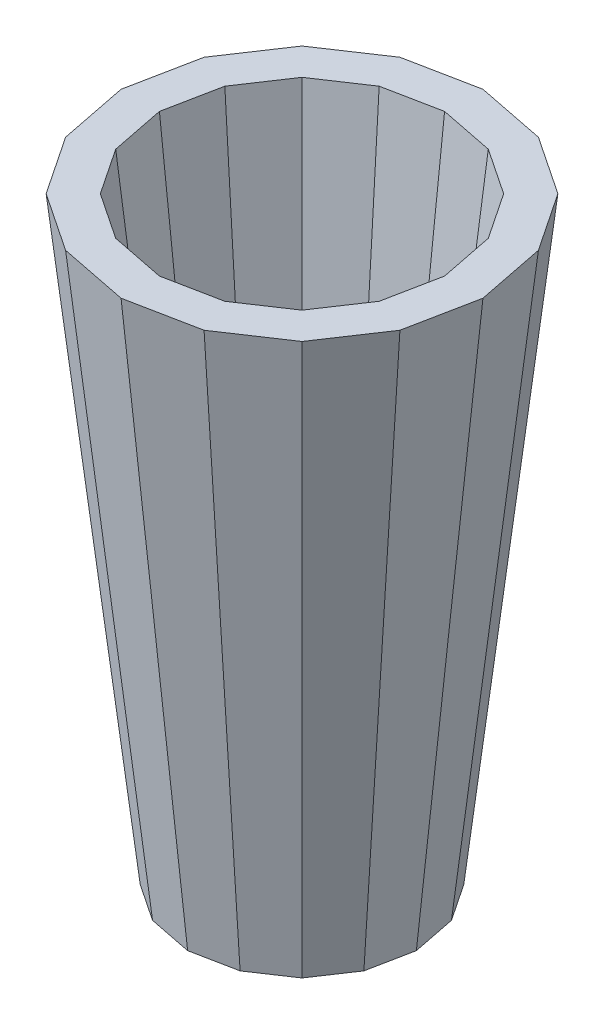
from build123d import *

# Parameters (mm, degrees)
SHELL1_T                = -19.05
SKETCH3_W               = 50.8
SKETCH3_H               = 50.8
BOSS_EXTRUDE1_DEPTH     = 35.56
CIRPATTERN1_COUNT       = 16
CUT_EXTRUDE1_REACH      = 373.537
SKETCH8_R               = 38.1
FILLET1_R               = 25.4
CUT_EXTRUDE2_DEPTH      = 372.53665238
CUT_EXTRUDE2_DEPTH_BACK = 25.4
SKETCH9_R               = 186.983253042


with BuildPart() as part:
    # Sketch1 → Loft1 section 0
    with BuildSketch(Plane(origin=(0, 0, 0), x_dir=(1, 0, 0), z_dir=(0, 1, 0))):
        with BuildLine():
            Line((120.431396889, 0), (111.264102658, 46.087100326))
            Line((111.264102658, 46.087100326), (85.157857408, 85.157857408))
            Line((85.157857408, 85.157857408), (46.087100326, 111.264102658))
            Line((46.087100326, 111.264102658), (0, 120.431396889))
            Line((0, 120.431396889), (-46.087100326, 111.264102658))
            Line((-46.087100326, 111.264102658), (-85.157857408, 85.157857408))
            Line((-85.157857408, 85.157857408), (-111.264102658, 46.087100326))
            Line((-111.264102658, 46.087100326), (-120.431396889, 0))
            Line((-120.431396889, 0), (-111.264102658, -46.087100326))
            Line((-111.264102658, -46.087100326), (-85.157857408, -85.157857408))
            Line((-85.157857408, -85.157857408), (-46.087100326, -111.264102658))
            Line((-46.087100326, -111.264102658), (0, -120.431396889))
            Line((0, -120.431396889), (46.087100326, -111.264102658))
            Line((46.087100326, -111.264102658), (85.157857408, -85.157857408))
            Line((85.157857408, -85.157857408), (111.264102658, -46.087100326))
            Line((111.264102658, -46.087100326), (120.431396889, 0))
        make_face()
    # Sketch2 → Loft1 section 1
    with BuildSketch(Plane(origin=(0, -558.8, 0), x_dir=(1, 0, 0), z_dir=(0, 1, 0))):
        with BuildLine():
            Line((58.269634692, 0), (53.834122858, 22.298823806))
            Line((53.834122858, 22.298823806), (41.202853828, 41.202853828))
            Line((41.202853828, 41.202853828), (22.298823806, 53.834122858))
            Line((22.298823806, 53.834122858), (0, 58.269634692))
            Line((0, 58.269634692), (-22.298823806, 53.834122858))
            Line((-22.298823806, 53.834122858), (-41.202853828, 41.202853828))
            Line((-41.202853828, 41.202853828), (-53.834122858, 22.298823806))
            Line((-53.834122858, 22.298823806), (-58.269634692, 0))
            Line((-58.269634692, 0), (-53.834122858, -22.298823806))
            Line((-53.834122858, -22.298823806), (-41.202853828, -41.202853828))
            Line((-41.202853828, -41.202853828), (-22.298823806, -53.834122858))
            Line((-22.298823806, -53.834122858), (0, -58.269634692))
            Line((0, -58.269634692), (22.298823806, -53.834122858))
            Line((22.298823806, -53.834122858), (41.202853828, -41.202853828))
            Line((41.202853828, -41.202853828), (53.834122858, -22.298823806))
            Line((53.834122858, -22.298823806), (58.269634692, 0))
        make_face()
    loft()

    # Shell1
    shell1_openings = [part.faces().sort_by_distance(p)[0] for p in [
        (0, -558.8, 0),
        (0, 0, 0),
    ]]
    offset(amount=SHELL1_T, openings=shell1_openings, kind=Kind.INTERSECTION)

    # Sketch3 → Boss-Extrude1 (add)
    with BuildSketch(Plane.XY):
        with Locations((-56.063793247, -203.2)):
            Rectangle(SKETCH3_W, SKETCH3_H)
    boss_extrude1 = extrude(amount=-BOSS_EXTRUDE1_DEPTH)

    # CirPattern1: Boss-Extrude1 ×16 about axis
    cirpattern1_axis = Axis((0, 0, 0), (0, 1, 0))
    for i in range(1, CIRPATTERN1_COUNT):
        add(boss_extrude1.rotate(cirpattern1_axis, i * 360 / CIRPATTERN1_COUNT))

    # Sketch6 → Cut-Revolve1 (revolve, cut)
    with BuildSketch(Plane.XY, mode=Mode.PRIVATE) as cut_revolve1_sk:
        with BuildLine():
            Line((-81.11418083, -177.8), (-12.701359037, -177.8))
            Line((-12.701359037, -177.8), (-12.701359037, -228.6))
            Line((-12.701359037, -228.6), (-30.663793247, -228.6))
            ThreePointArc((-30.663793247, -228.6), (-63.531337698, -210.789754977), (-81.11418083, -177.8))
        make_face()
    revolve(cut_revolve1_sk.sketch.rotate(Axis((0, -222.066544959, 0), (0, 1, 0)), 180), axis=Axis((0, -222.066544959, 0), (0, 1, 0)), mode=Mode.SUBTRACT)

    # Sketch8 → Cut-Extrude1 (cut, up to next)
    with BuildSketch(Plane(origin=(0, -228.6, 0), x_dir=(1, 0, 0), z_dir=(0, 1, 0)), mode=Mode.PRIVATE) as cut_extrude1_sk1:
        with Locations(Location((0, 0, 0), (0, 0, 180))):
            Circle(SKETCH8_R)
    cut_extrude1_tool1 = extrude(cut_extrude1_sk1.sketch, amount=CUT_EXTRUDE1_REACH, mode=Mode.PRIVATE) & part.part
    add(cut_extrude1_tool1.solids().sort_by_distance((0, -228.6, 0))[0], mode=Mode.SUBTRACT)

    # Fillet1
    # the kernel refuses this fillet: 25.4 mm, written as the material it takes off along each edge
    with BuildSketch(Plane(origin=(0, -228.6, 0), x_dir=(-1, 0, 0), z_dir=(0, 0, -1))) as fillet1_piece_1:
        with BuildLine():
            CenterArc((47.997893869, 25.4), FILLET1_R, 247.065356901, 22.934643099)
            Line((38.1, 2.007871047), (37.902042123, 1.540028468))
            ThreePointArc((37.902042123, 1.540028468), (37.592, 1.003935523), (37.592, 0))
            Line((37.592, 0), (38.1, -0.508))
            Line((38.1, -0.508), (47.997893869, -0.508))
            Line((47.997893869, -0.508), (47.997893869, 0))
        make_face()
    revolve(axis=Axis((0, -228.6, 0), (0, 1, 0)), mode=Mode.SUBTRACT)

    # Sketch9 → Cut-Extrude2 (cut, two sides: drawn at the far end of the back side and taken through both)
    with BuildSketch(Plane(origin=(0, -228.6, 0), x_dir=(1, 0, 0), z_dir=(0, 1, 0)).offset(-CUT_EXTRUDE2_DEPTH_BACK)):
        Circle(SKETCH9_R)
    extrude(amount=CUT_EXTRUDE2_DEPTH + CUT_EXTRUDE2_DEPTH_BACK, mode=Mode.SUBTRACT)


solid = part.part
